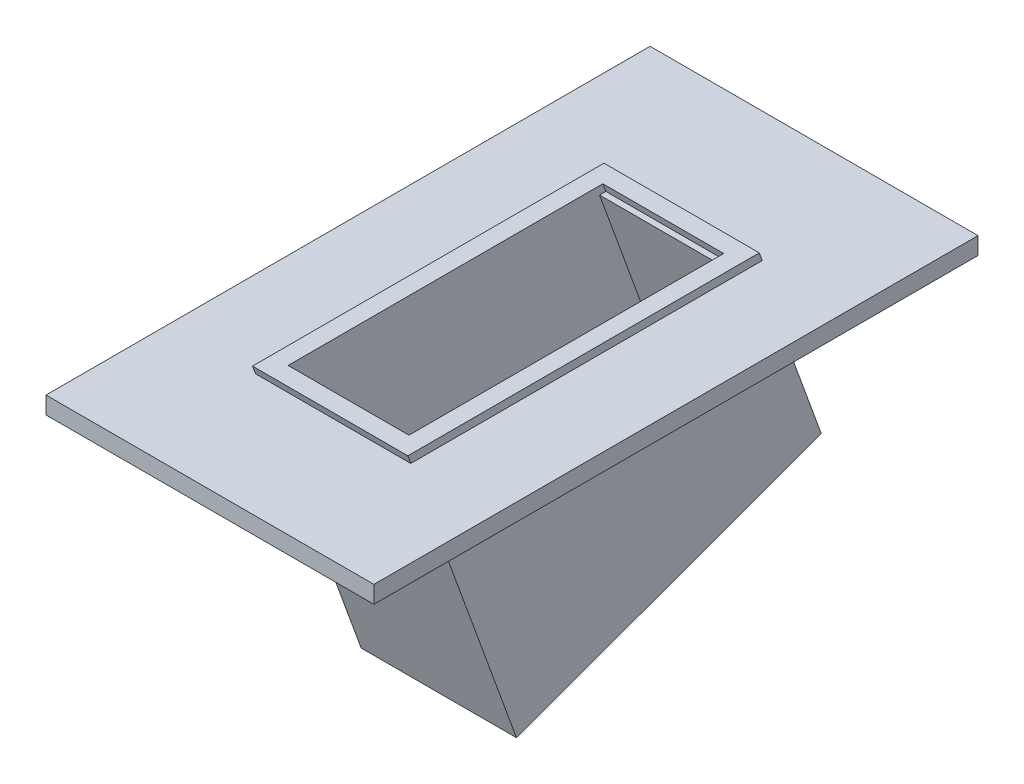
from build123d import *

# Parameters (mm, degrees)
BOSS_EXTRU_1_DEPTH      = 18
BOSS_EXTRU_4_DEPTH      = 1
COQUE7_START            = 2
COQUE7_DEPTH            = 14
ESQUISSE2_R             = 1
ESQUISSE2_W             = 11
ESQUISSE2_H             = 23
ENL_V_MAT_EXTRU_1_DEPTH = 69.486359517
ESQUISSE7_W             = 70
ESQUISSE7_H             = 2
BOSS_EXTRU_5_DEPTH      = 10
ESQUISSE8_W             = 70
ESQUISSE8_H             = 2
BOSS_EXTRU_6_DEPTH      = 10


# Read off the part's stored shape, not the designer's step: Coque7
with BuildPart() as part:
    # Esquisse1 → Boss.-Extru.1 (new body)
    with BuildSketch(Plane(origin=(0, 0, 0), x_dir=(0, 0, -1), z_dir=(1, 0, 0))):
        Polygon((-35.320888862, -14.855752194), (-40, -2), (-55, -2), (-55, 0), (-40, 0), (0, 0), (15, 0), (15, -2), (0, -2), (6.840402867, -20.793852416), (-28.480485996, -33.649604609), align=None)
    extrude(amount=BOSS_EXTRU_1_DEPTH)

    # Esquisse3D1 → Boss.-Extru.4 (add, along a direction that is not the sketch's normal)
    with BuildSketch(Plane(origin=(0, 0, 0), x_dir=(0.40423775033266973, 0, 0.9146539461490243), z_dir=(0, -1, 0))):
        Polygon((0, 0), (37.251971468, 16.463771031), (44.528250974, 0), (7.276279506, -16.463771031), align=None)
    extrude(amount=-BOSS_EXTRU_4_DEPTH, dir=(0, -0.9396926207859081, -0.3420201433256695))

    # Coque7 outline → Coque7 (cut)
    with BuildSketch(Plane.YZ.offset(COQUE7_START)):
        Polygon((0, 2.856296013), (0, 2.128355545), (0.939692621, 2.470375688), (0.939692621, 38.941605067), (-31.086179081, 27.285141041), (-19.598507461, -4.276977338), align=None)
    extrude(amount=COQUE7_DEPTH, mode=Mode.SUBTRACT)

    # Esquisse2 → Enlèv. mat.-Extru.1 (cut, through all)
    with BuildSketch(Plane(origin=(0, -20.559896859, -7.483190476), x_dir=(1, 0, 0), z_dir=(0, -0.9396926207859082, -0.34202014332566943))):
        with Locations(Location((6.5, 33.277892702, 0), (0, 0, 270))):
            Circle(ESQUISSE2_R)
        with Locations(Location((11.5, 33.277892702, 0), (0, 0, 90))):
            Circle(ESQUISSE2_R)
        with Locations(Location((11.5, 5.677892702, 0), (0, 0, 270))):
            Circle(ESQUISSE2_R)
        with Locations(Location((6.5, 5.677892702, 0), (0, 0, 90))):
            Circle(ESQUISSE2_R)
        with Locations((9, 19.477892702)):
            Rectangle(ESQUISSE2_W, ESQUISSE2_H)
    extrude(amount=-ENL_V_MAT_EXTRU_1_DEPTH, mode=Mode.SUBTRACT)

    # Esquisse7 → Boss.-Extru.5 (add)
    with BuildSketch(Plane.ZY):
        with Locations((20, -1)):
            Rectangle(ESQUISSE7_W, ESQUISSE7_H)
    extrude(amount=BOSS_EXTRU_5_DEPTH)

    # Esquisse8 → Boss.-Extru.6 (add)
    with BuildSketch(Plane(origin=(18, 0, 0), x_dir=(0, 0, -1), z_dir=(1, 0, 0))):
        with Locations((-20, -1)):
            Rectangle(ESQUISSE8_W, ESQUISSE8_H)
    extrude(amount=BOSS_EXTRU_6_DEPTH)


solid = part.part
